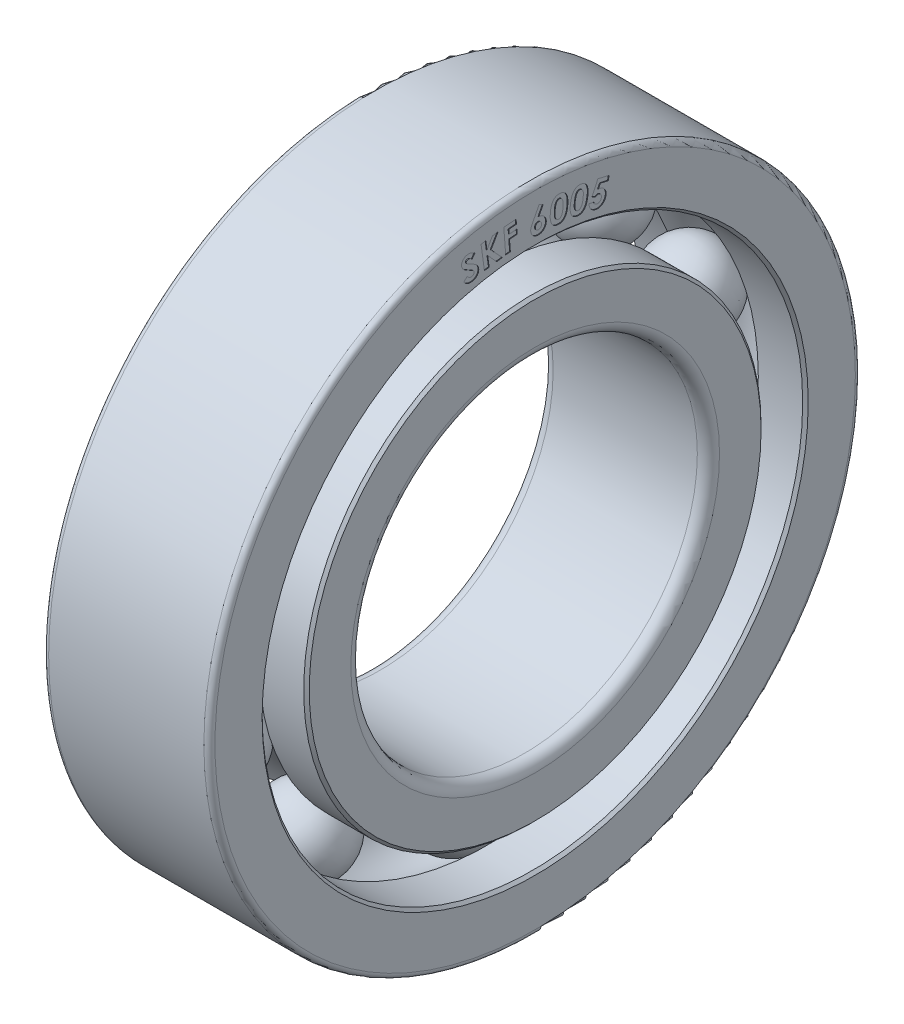
from build123d import *

# Parameters (mm, degrees)
CIRPATTERN1_COUNT = 10
WRAP1_START       = -0.05
WRAP1_DEPTH       = 0.05


# Read off the part's stored shape, not the designer's step: Wrap1
with BuildPart() as part:
    # Sketch1 → Revolve1 (revolve)
    with BuildSketch(Plane.XY, mode=Mode.PRIVATE) as revolve1_sk:
        with BuildLine():
            Line((-11.8, 19.5), (-8.598076211, 19.5))
            ThreePointArc((-8.598076211, 19.5), (-6, 21), (-3.401923789, 19.5))
            Line((-3.401923789, 19.5), (-0.2, 19.5))
            Line((-0.2, 19.5), (0, 19.7))
            Line((0, 19.7), (0, 23.1))
            ThreePointArc((0, 23.1), (-0.117157288, 23.382842712), (-0.4, 23.5))
            Line((-0.4, 23.5), (-11.6, 23.5))
            ThreePointArc((-11.6, 23.5), (-11.882842712, 23.382842712), (-12, 23.1))
            Line((-12, 23.1), (-12, 19.7))
            Line((-12, 19.7), (-11.8, 19.5))
        make_face()
        with BuildLine():
            Line((-0.8, 12.5), (-11.2, 12.5))
            ThreePointArc((-11.2, 12.5), (-11.765685425, 12.734314575), (-12, 13.3))
            Line((-12, 13.3), (-12, 16.3))
            Line((-12, 16.3), (-11.8, 16.5))
            Line((-11.8, 16.5), (-8.598076211, 16.5))
            ThreePointArc((-8.598076211, 16.5), (-6, 15), (-3.401923789, 16.5))
            Line((-3.401923789, 16.5), (-0.2, 16.5))
            Line((-0.2, 16.5), (0, 16.3))
            Line((0, 16.3), (0, 13.3))
            ThreePointArc((0, 13.3), (-0.234314575, 12.734314575), (-0.8, 12.5))
        make_face()
    revolve(revolve1_sk.sketch.rotate(Axis((0, 0, 0), (-1, 0, 0)), 90), axis=Axis((0, 0, 0), (-1, 0, 0)))

    # Wrap1 outline → Wrap1 (cut)
    # profile 1 of 7: a face of its own
    with BuildSketch(Plane(origin=(0, 0, 0), x_dir=(0, 0, -1), z_dir=(1, 0, 0)).offset(WRAP1_START)):
        with BuildLine():
            add(Edge.make_bspline(
                [(4.560573664, 20.891885224), (4.57091226, 20.892304512), (4.591237683, 20.893128822), (4.621190564, 20.891284417), (4.649839661, 20.888951427), (4.668172845, 20.885096082), (4.677040011, 20.883231378)],
                knots=[0, 0, 0, 0, 0.264824421, 0.520638247, 0.768148301, 1, 1, 1, 1], degree=3))
            Line((4.560573664, 20.891885224), (4.702640972, 21.192966955))
            Line((4.702640972, 21.192966955), (5.270549626, 21.066043878))
            Line((5.270549626, 21.066043878), (5.338698664, 21.371452531))
            Line((5.338698664, 21.371452531), (4.523434241, 21.553543878))
            Line((4.523434241, 21.553543878), (4.096871741, 20.634072724))
            Line((4.096871741, 20.634072724), (4.353241934, 20.513279455))
            add(Edge.make_bspline(
                [(4.587977511, 20.574938108), (4.578871157, 20.576603198), (4.560526351, 20.57995753), (4.53227479, 20.580928077), (4.503463339, 20.57834958), (4.474240737, 20.572080324), (4.4444849, 20.562508644), (4.414016832, 20.549976309), (4.383434084, 20.533181189), (4.363487798, 20.520033212), (4.353241934, 20.513279455)],
                knots=[0, 0, 0, 0, 0.111054174, 0.22371933, 0.338191352, 0.457650474, 0.581812816, 0.713158384, 0.852657264, 1, 1, 1, 1], degree=3))
            add(Edge.make_bspline(
                [(4.771511164, 20.244649647), (4.77347676, 20.254598544), (4.777316005, 20.274030943), (4.780229083, 20.303121047), (4.780437045, 20.331202417), (4.779067246, 20.35858187), (4.773587328, 20.384915787), (4.766618403, 20.410606569), (4.756683774, 20.435325144), (4.744523245, 20.459008517), (4.730261407, 20.481014762), (4.71454058, 20.501244341), (4.697374804, 20.519268728), (4.678397363, 20.534851009), (4.658047369, 20.548416448), (4.636044546, 20.559394985), (4.612700933, 20.568736148), (4.596329856, 20.572842892), (4.587977511, 20.574938108)],
                knots=[0, 0, 0, 0, 0.072112555, 0.14085178, 0.207545393, 0.271810935, 0.3353616, 0.398427314, 0.460980952, 0.524456807, 0.587539905, 0.647229237, 0.706488392, 0.764178689, 0.821564081, 0.880065939, 0.938810946, 1, 1, 1, 1], degree=3))
            add(Edge.make_bspline(
                [(4.444467895, 20.020731378), (4.453577211, 20.019007176), (4.471457835, 20.01562275), (4.498399716, 20.013376234), (4.524728181, 20.014204226), (4.550631263, 20.017325264), (4.575942553, 20.023655275), (4.60102305, 20.032252158), (4.625466521, 20.043903201), (4.649301573, 20.057934802), (4.671771641, 20.074351404), (4.692468056, 20.092798241), (4.710999265, 20.113267867), (4.72778586, 20.135522417), (4.741542039, 20.160283441), (4.754098962, 20.18639181), (4.764237762, 20.214671298), (4.769049275, 20.234502622), (4.771511164, 20.244649647)],
                knots=[0, 0, 0, 0, 0.062787982, 0.12324618, 0.182714598, 0.240994711, 0.299654761, 0.359145477, 0.420344987, 0.482772846, 0.546295829, 0.60858012, 0.670259929, 0.733127073, 0.796962466, 0.861802797, 0.929289116, 1, 1, 1, 1], degree=3))
            add(Edge.make_bspline(
                [(4.230285203, 20.242486185), (4.234317444, 20.227914289), (4.24212862, 20.199685909), (4.260462765, 20.160683118), (4.281730238, 20.125306039), (4.308154262, 20.094889185), (4.337646439, 20.068742814), (4.370572003, 20.047707379), (4.406201009, 20.031076605), (4.431600431, 20.024210021), (4.444467895, 20.020731378)],
                knots=[0, 0, 0, 0, 0.139108732, 0.269478593, 0.395828309, 0.518386693, 0.639271502, 0.757881256, 0.877341528, 1, 1, 1, 1], degree=3))
            Line((4.230285203, 20.242486185), (3.882689049, 20.320370801))
            add(Edge.make_bspline(
                [(4.368386164, 19.714962147), (4.350261461, 19.71932166), (4.314421102, 19.727942299), (4.263165616, 19.746350623), (4.214193044, 19.767084914), (4.168545015, 19.792180797), (4.125168953, 19.820215192), (4.085394743, 19.852576909), (4.047710356, 19.887611446), (4.013849502, 19.926492732), (3.982966322, 19.967942802), (3.956453429, 20.012026891), (3.933334002, 20.058039733), (3.915173553, 20.106486789), (3.90063424, 20.156869968), (3.890117143, 20.209432701), (3.884001112, 20.2642157), (3.883130304, 20.301485479), (3.882689049, 20.320370801)],
                knots=[0, 0, 0, 0, 0.066224855, 0.130955116, 0.193345704, 0.255103913, 0.315901223, 0.376694029, 0.437149529, 0.498609906, 0.559714257, 0.620683999, 0.681260181, 0.74252418, 0.804328196, 0.867512637, 0.932866075, 1, 1, 1, 1], degree=3))
            add(Edge.make_bspline(
                [(5.098554434, 20.185154455), (5.093439977, 20.164476887), (5.083363052, 20.123736235), (5.061296044, 20.065560964), (5.035182373, 20.010756391), (5.003475734, 19.960048581), (4.967277835, 19.912922145), (4.926263456, 19.869377761), (4.880307078, 19.82952644), (4.829675977, 19.794319476), (4.776494671, 19.763384419), (4.721433566, 19.738306524), (4.665207162, 19.719484253), (4.60795816, 19.706435148), (4.549495483, 19.699084472), (4.489925568, 19.698124028), (4.429157087, 19.703124833), (4.388880246, 19.71097019), (4.368386164, 19.714962147)],
                knots=[0, 0, 0, 0, 0.065986739, 0.130012529, 0.192511703, 0.253934026, 0.315051522, 0.376473845, 0.439082902, 0.503283044, 0.567391197, 0.629595286, 0.690518214, 0.750904285, 0.811360451, 0.872856205, 0.935305369, 1, 1, 1, 1], degree=3))
            add(Edge.make_bspline(
                [(4.677040011, 20.883231378), (4.696252679, 20.878413307), (4.733991574, 20.868949309), (4.788033274, 20.848966561), (4.838317743, 20.824311416), (4.885227449, 20.795552568), (4.927900149, 20.761506639), (4.9675874, 20.723731566), (5.002831299, 20.68064031), (5.034927209, 20.634155641), (5.062026299, 20.584284392), (5.084383845, 20.532488251), (5.10057692, 20.478738966), (5.111410735, 20.423299894), (5.116918004, 20.366047392), (5.116269103, 20.307021318), (5.110696167, 20.246292938), (5.102648617, 20.205770303), (5.098554434, 20.185154455)],
                knots=[0, 0, 0, 0, 0.065043487, 0.127763062, 0.188869411, 0.248811184, 0.308141075, 0.367906987, 0.428478918, 0.490692979, 0.553251983, 0.614644755, 0.675730685, 0.737299736, 0.799973298, 0.864341992, 0.930984128, 1, 1, 1, 1], degree=3))
        make_face()
    # profile 2 of 7: a face of its own
    with BuildSketch(Plane(origin=(0, 0, 0), x_dir=(0, 0, -1), z_dir=(1, 0, 0)).offset(WRAP1_START)):
        with BuildLine():
            add(Edge.make_bspline(
                [(3.793354577, 20.820619921), (3.789381765, 20.791976698), (3.781664409, 20.736336027), (3.766556806, 20.655857606), (3.750590292, 20.580495884), (3.732679836, 20.510279927), (3.712447493, 20.445500596), (3.690904415, 20.385724259), (3.667658112, 20.331176893), (3.642155704, 20.281836452), (3.615380218, 20.236822277), (3.587120888, 20.195662216), (3.558017807, 20.157737957), (3.527724883, 20.12320261), (3.495797672, 20.092589102), (3.463049425, 20.064860531), (3.428580284, 20.041161501), (3.393203123, 20.020277849), (3.355988569, 20.003364377), (3.317345579, 19.989207567), (3.276835436, 19.97823136), (3.234388147, 19.971440002), (3.190480632, 19.966382865), (3.144653535, 19.965580178), (3.097204384, 19.967697495), (3.06509272, 19.971387635), (3.048763231, 19.973264152)],
                knots=[0, 0, 0, 0, 0.067702401, 0.131514772, 0.191683064, 0.248066057, 0.301119717, 0.350531739, 0.396798805, 0.439846697, 0.480486813, 0.519361801, 0.556683775, 0.59237304, 0.626806247, 0.660174034, 0.692729609, 0.724636415, 0.756243924, 0.788295624, 0.820927748, 0.854333493, 0.888863177, 0.92433428, 0.961522312, 1, 1, 1, 1], degree=3))
            add(Edge.make_bspline(
                [(3.2914315, 21.837446845), (3.307343922, 21.835049605), (3.338541977, 21.830349553), (3.383869885, 21.819188442), (3.427307302, 21.805966809), (3.468757722, 21.789893129), (3.507867913, 21.77047046), (3.545197976, 21.748991716), (3.580149849, 21.724307654), (3.613210007, 21.697226681), (3.643890162, 21.667120361), (3.672522662, 21.634418901), (3.698118247, 21.598335574), (3.721551191, 21.559628312), (3.743098064, 21.518128678), (3.761090678, 21.4732559), (3.777536609, 21.425926087), (3.791187202, 21.375440284), (3.802582649, 21.321328753), (3.8103566, 21.262871521), (3.814681402, 21.20001536), (3.817194957, 21.132769642), (3.815195606, 21.061081064), (3.811438087, 20.984821577), (3.804187199, 20.9041125), (3.79703187, 20.848962706), (3.793354577, 20.820619921)],
                knots=[0, 0, 0, 0, 0.037496831, 0.073516668, 0.108702927, 0.143305305, 0.177014649, 0.210415134, 0.243608117, 0.276650559, 0.3099392, 0.343705559, 0.377841921, 0.412922031, 0.449138596, 0.486707595, 0.525519346, 0.565896619, 0.608540729, 0.654350091, 0.703241101, 0.755385757, 0.811157191, 0.870360072, 0.933374973, 1, 1, 1, 1], degree=3))
            add(Edge.make_bspline(
                [(2.792032462, 21.659682421), (2.808826941, 21.676935207), (2.841770054, 21.71077731), (2.897016125, 21.753415516), (2.955219544, 21.788131978), (3.016512523, 21.81469159), (3.081057876, 21.83282485), (3.148629858, 21.842760917), (3.219357937, 21.845255997), (3.267063335, 21.840087129), (3.2914315, 21.837446845)],
                knots=[0, 0, 0, 0, 0.130496671, 0.255974998, 0.37731346, 0.497357162, 0.617292779, 0.739947003, 0.867163576, 1, 1, 1, 1], degree=3))
            add(Edge.make_bspline(
                [(2.545758424, 20.972062229), (2.551568028, 21.011296669), (2.562781519, 21.087025584), (2.584192851, 21.195803546), (2.609864303, 21.295399255), (2.638302736, 21.386316546), (2.67102736, 21.46793438), (2.707186251, 21.540584312), (2.746291412, 21.604866266), (2.777162496, 21.641862228), (2.792032462, 21.659682421)],
                knots=[0, 0, 0, 0, 0.160725242, 0.310226129, 0.449042117, 0.577363454, 0.696036472, 0.804954813, 0.906050749, 1, 1, 1, 1], degree=3))
            add(Edge.make_bspline(
                [(3.048763231, 19.973264152), (3.032494969, 19.97567632), (3.000474441, 19.980424146), (2.954015439, 19.991394571), (2.909818323, 20.004759162), (2.8678648, 20.020467368), (2.828500142, 20.039312958), (2.7915195, 20.060701867), (2.756847291, 20.084478036), (2.724485416, 20.110863329), (2.694830105, 20.140445364), (2.667086512, 20.172393654), (2.641645143, 20.207189886), (2.619038466, 20.245047926), (2.598040873, 20.285263641), (2.579675372, 20.328484861), (2.563506797, 20.374386762), (2.549219717, 20.423284336), (2.538053288, 20.476070938), (2.529944584, 20.533168705), (2.524357972, 20.594907393), (2.523124502, 20.661358647), (2.523462856, 20.732460276), (2.528253412, 20.808209803), (2.535331853, 20.888664695), (2.542214503, 20.943715972), (2.545758424, 20.972062229)],
                knots=[0, 0, 0, 0, 0.038772736, 0.07631568, 0.112453997, 0.147622079, 0.181855821, 0.215257946, 0.248281444, 0.280910845, 0.313583312, 0.346943312, 0.380622141, 0.415089802, 0.450842511, 0.487542343, 0.525735655, 0.565568444, 0.607599884, 0.652859579, 0.701518419, 0.753695438, 0.809541141, 0.869166135, 0.9326328, 1, 1, 1, 1], degree=3))
        make_face()
        with BuildLine():
            add(Edge.make_bspline(
                [(2.882176693, 20.919417998), (2.878712217, 20.892398827), (2.872072473, 20.840615994), (2.865990061, 20.765657872), (2.86297755, 20.696975499), (2.86306172, 20.63425606), (2.866895446, 20.577746201), (2.874022205, 20.527224898), (2.884008627, 20.482710311), (2.898256102, 20.444161035), (2.915638245, 20.411036186), (2.934257522, 20.381680066), (2.95485163, 20.355896395), (2.978217946, 20.334653892), (3.00313341, 20.316670808), (3.030291501, 20.302905898), (3.059335122, 20.292456015), (3.079816376, 20.289055541), (3.090229577, 20.287326652)],
                knots=[0, 0, 0, 0, 0.110494452, 0.21176504, 0.304976072, 0.389330268, 0.466069304, 0.534542058, 0.596159802, 0.650774051, 0.700713193, 0.747645948, 0.791661433, 0.834104032, 0.875367953, 0.915928741, 0.957255989, 1, 1, 1, 1], degree=3))
            add(Edge.make_bspline(
                [(3.256455539, 21.515812229), (3.242516413, 21.517046427), (3.214913105, 21.51949048), (3.173666383, 21.514130872), (3.133965346, 21.501527072), (3.102547283, 21.485388105), (3.078374099, 21.468629833), (3.060850502, 21.453028778), (3.043794358, 21.435048318), (3.028060902, 21.414015791), (3.012047246, 21.391221254), (2.997278718, 21.36531301), (2.983397743, 21.336757684), (2.969488627, 21.305610157), (2.956463005, 21.27106951), (2.944309732, 21.232615711), (2.932453955, 21.190299892), (2.921358889, 21.143833449), (2.910489012, 21.093490233), (2.900596087, 21.038968134), (2.890700535, 20.980588831), (2.88507638, 20.940227426), (2.882176693, 20.919417998)],
                knots=[0, 0, 0, 0, 0.053456951, 0.105859485, 0.15796816, 0.212307328, 0.240395868, 0.270398578, 0.301979904, 0.335118981, 0.370862449, 0.408594922, 0.449141373, 0.492411897, 0.539166773, 0.590398232, 0.646787929, 0.70739917, 0.773292727, 0.843970679, 0.919554814, 1, 1, 1, 1], degree=3))
            add(Edge.make_bspline(
                [(3.456575731, 20.862446845), (3.460119038, 20.89043125), (3.466936256, 20.944272419), (3.473892217, 21.021955238), (3.477228632, 21.093300684), (3.477342877, 21.158155521), (3.474466594, 21.216732394), (3.467574288, 21.268906419), (3.458062005, 21.314883241), (3.443971172, 21.354480295), (3.42760025, 21.388835813), (3.4091712, 21.41889462), (3.388964976, 21.445246516), (3.366473641, 21.467403975), (3.341959223, 21.485707759), (3.315519493, 21.500369857), (3.286721846, 21.510584658), (3.266618928, 21.514056817), (3.256455539, 21.515812229)],
                knots=[0, 0, 0, 0, 0.111913898, 0.215319034, 0.309363583, 0.395203079, 0.472577755, 0.541844536, 0.603863567, 0.658462339, 0.708161557, 0.754618193, 0.798116897, 0.839595023, 0.879462814, 0.919159105, 0.959129443, 1, 1, 1, 1], degree=3))
            add(Edge.make_bspline(
                [(3.301888231, 20.382158383), (3.310822902, 20.394356767), (3.329590974, 20.419980558), (3.353319227, 20.464164176), (3.375829473, 20.514458225), (3.395597804, 20.571544174), (3.414046097, 20.63495365), (3.430501447, 20.704878761), (3.444838108, 20.781431218), (3.452566059, 20.834771212), (3.456575731, 20.862446845)],
                knots=[0, 0, 0, 0, 0.088884478, 0.186709757, 0.294358697, 0.412921039, 0.541844703, 0.682862232, 0.835452017, 1, 1, 1, 1], degree=3))
            add(Edge.make_bspline(
                [(3.090229577, 20.287326652), (3.100314732, 20.286324169), (3.120118606, 20.284355626), (3.149528436, 20.286253015), (3.17777899, 20.292145852), (3.205107377, 20.301843869), (3.23106356, 20.316258889), (3.256306484, 20.334039495), (3.280165748, 20.356237458), (3.294498084, 20.373339895), (3.301888231, 20.382158383)],
                knots=[0, 0, 0, 0, 0.124617305, 0.244706755, 0.361082867, 0.479038204, 0.600207723, 0.725438522, 0.858428536, 1, 1, 1, 1], degree=3))
        make_face(mode=Mode.SUBTRACT)
    # profile 3 of 7: a face of its own
    with BuildSketch(Plane(origin=(0, 0, 0), x_dir=(0, 0, -1), z_dir=(1, 0, 0)).offset(WRAP1_START)):
        with BuildLine():
            add(Edge.make_bspline(
                [(2.35098723, 21.024524151), (2.348669505, 20.995657324), (2.3441621, 20.939518469), (2.334179993, 20.85803179), (2.323097733, 20.78154415), (2.308732855, 20.710307328), (2.293206437, 20.644024799), (2.275244233, 20.582953666), (2.25501286, 20.52707508), (2.232655974, 20.476027307), (2.208224469, 20.429442102), (2.183064901, 20.386123257), (2.156022964, 20.346609369), (2.127690081, 20.310168666), (2.098071328, 20.276979916), (2.066398349, 20.247777369), (2.033827123, 20.221453293), (1.999573574, 20.198704856), (1.963410633, 20.179414819), (1.925490632, 20.163258228), (1.885646848, 20.149749787), (1.843755553, 20.139733748), (1.799966542, 20.132975775), (1.75431659, 20.129079462), (1.706608578, 20.127817536), (1.674178659, 20.129694368), (1.657597807, 20.130653959)],
                knots=[0, 0, 0, 0, 0.067606406, 0.131477778, 0.191643372, 0.24799864, 0.301088721, 0.350545761, 0.396529971, 0.439753828, 0.480545373, 0.519288373, 0.556648946, 0.592238081, 0.627009069, 0.660366415, 0.692709753, 0.724698103, 0.756210247, 0.788267452, 0.820835227, 0.854322162, 0.888693385, 0.924186138, 0.961237695, 1, 1, 1, 1], degree=3))
            add(Edge.make_bspline(
                [(1.785963192, 22.011783767), (1.801976137, 22.010321968), (1.83354009, 22.00744054), (1.879791144, 21.999363823), (1.924165323, 21.988663476), (1.966585322, 21.974882637), (2.007088948, 21.958260027), (2.045742217, 21.93884886), (2.082326136, 21.91629871), (2.117033861, 21.891102557), (2.149659074, 21.862699511), (2.180351047, 21.8315897), (2.208049921, 21.796801573), (2.234343477, 21.759770193), (2.257451985, 21.719026194), (2.279417747, 21.67597116), (2.297879611, 21.629299245), (2.315062764, 21.579859841), (2.329624542, 21.526301532), (2.340971752, 21.468323664), (2.3494197, 21.405700289), (2.355777284, 21.338467204), (2.358092176, 21.266492319), (2.359190321, 21.189893251), (2.356357472, 21.108719461), (2.352811235, 21.053121126), (2.35098723, 21.024524151)],
                knots=[0, 0, 0, 0, 0.03735145, 0.073625396, 0.108985718, 0.143343531, 0.177160134, 0.210634766, 0.243734452, 0.276917694, 0.310180767, 0.344151569, 0.378305578, 0.413404624, 0.449571965, 0.487043307, 0.525630502, 0.566082972, 0.608632153, 0.654478221, 0.703258975, 0.755424354, 0.811328002, 0.870541154, 0.933412911, 1, 1, 1, 1], degree=3))
            add(Edge.make_bspline(
                [(1.297020884, 21.803009728), (1.312842002, 21.821303841), (1.34377136, 21.857067758), (1.396284876, 21.903341602), (1.452605754, 21.941413082), (1.51230321, 21.972092391), (1.575849849, 21.99407162), (1.642739762, 22.008715426), (1.713401364, 22.014773318), (1.761443457, 22.012793981), (1.785963192, 22.011783767)],
                knots=[0, 0, 0, 0, 0.130738837, 0.255586769, 0.377322549, 0.497715476, 0.61760867, 0.740047481, 0.867325375, 1, 1, 1, 1], degree=3))
            add(Edge.make_bspline(
                [(1.092573769, 21.099524151), (1.095950868, 21.139223463), (1.102464869, 21.215798467), (1.117514973, 21.325949442), (1.136891081, 21.427188994), (1.160187916, 21.519711761), (1.187216053, 21.603697152), (1.219044939, 21.678738902), (1.254512408, 21.745439471), (1.283219419, 21.784318069), (1.297020884, 21.803009728)],
                knots=[0, 0, 0, 0, 0.160953581, 0.310459312, 0.448932877, 0.5771911, 0.695741221, 0.804966732, 0.90623388, 1, 1, 1, 1], degree=3))
            add(Edge.make_bspline(
                [(1.657597807, 20.130653959), (1.641102566, 20.132103972), (1.608696484, 20.134952625), (1.561529026, 20.143104351), (1.516359604, 20.153367174), (1.473637826, 20.167133704), (1.433056801, 20.183442863), (1.394484735, 20.202076496), (1.358514696, 20.224281805), (1.324387714, 20.248819872), (1.292546855, 20.276229886), (1.263254926, 20.306877397), (1.235692472, 20.340195387), (1.210183848, 20.376445106), (1.187116772, 20.415784473), (1.165645425, 20.457690035), (1.146802933, 20.502745377), (1.129502547, 20.550761575), (1.115094956, 20.60282531), (1.103261055, 20.65941902), (1.094342387, 20.720957602), (1.088347688, 20.78727723), (1.085152088, 20.858503614), (1.085039019, 20.934512875), (1.087030436, 21.015455094), (1.090688211, 21.070928158), (1.092573769, 21.099524151)],
                knots=[0, 0, 0, 0, 0.038920831, 0.076462755, 0.112453508, 0.147758619, 0.181871669, 0.215240199, 0.248345578, 0.281134582, 0.313996585, 0.346976262, 0.380701939, 0.415594004, 0.451074018, 0.487855052, 0.526227144, 0.565827493, 0.607793741, 0.653134948, 0.701697404, 0.753921297, 0.809655867, 0.86928974, 0.932619734, 1, 1, 1, 1], degree=3))
        make_face()
        with BuildLine():
            add(Edge.make_bspline(
                [(1.432597807, 21.067432805), (1.430854921, 21.040278805), (1.427502451, 20.988047631), (1.42555982, 20.912749475), (1.426952183, 20.843686096), (1.431135829, 20.780975892), (1.438030549, 20.724531084), (1.448406516, 20.674593107), (1.461547789, 20.630895165), (1.477911667, 20.59319875), (1.496845913, 20.560835808), (1.517611998, 20.53274452), (1.539934713, 20.508359969), (1.564272466, 20.487941964), (1.590466647, 20.471500428), (1.618524581, 20.459173917), (1.648382142, 20.450631436), (1.669083309, 20.448382335), (1.679593, 20.447240498)],
                knots=[0, 0, 0, 0, 0.110065989, 0.211713775, 0.304600997, 0.389403173, 0.465873356, 0.534436415, 0.595492573, 0.650143537, 0.700261321, 0.746841528, 0.791225696, 0.833682502, 0.874964899, 0.915890712, 0.957298901, 1, 1, 1, 1], degree=3))
            add(Edge.make_bspline(
                [(1.770818961, 21.687264536), (1.75673516, 21.687629143), (1.728956661, 21.688348285), (1.687757467, 21.680957189), (1.648894787, 21.665732972), (1.618180845, 21.647851899), (1.595501267, 21.629249054), (1.578662791, 21.612884878), (1.56286775, 21.593761332), (1.548178504, 21.571808716), (1.533671278, 21.547777118), (1.520251978, 21.52090637), (1.508387066, 21.491273065), (1.496073809, 21.459388026), (1.48532021, 21.423925677), (1.475400406, 21.384789665), (1.465862362, 21.341664811), (1.457858178, 21.294568193), (1.450194017, 21.24348627), (1.443480598, 21.188407352), (1.43721284, 21.129283502), (1.434167993, 21.088476443), (1.432597807, 21.067432805)],
                knots=[0, 0, 0, 0, 0.053667675, 0.10585263, 0.158411185, 0.212295993, 0.240663866, 0.270180285, 0.301776072, 0.335108668, 0.37090051, 0.408849287, 0.449566136, 0.492674861, 0.539246264, 0.590865748, 0.646736447, 0.707742787, 0.77313022, 0.843847516, 0.919474316, 1, 1, 1, 1], degree=3))
            add(Edge.make_bspline(
                [(2.010963192, 21.04579819), (2.012883488, 21.07403247), (2.016574325, 21.128299168), (2.018094766, 21.20648772), (2.017780996, 21.278064549), (2.013948765, 21.343086372), (2.006862766, 21.401503633), (1.996993327, 21.45327649), (1.984178898, 21.498389981), (1.968301133, 21.537247055), (1.94940535, 21.57027938), (1.929748239, 21.599655598), (1.907567815, 21.624480737), (1.88409676, 21.645930686), (1.858308715, 21.662577453), (1.830664346, 21.674941115), (1.801489274, 21.683931997), (1.78109676, 21.686147783), (1.770818961, 21.687264536)],
                knots=[0, 0, 0, 0, 0.112021211, 0.215306406, 0.309527997, 0.395339406, 0.473011103, 0.542348697, 0.603789507, 0.658401616, 0.708039979, 0.754235914, 0.798059935, 0.839512877, 0.879768689, 0.918952797, 0.959152323, 1, 1, 1, 1], degree=3))
            add(Edge.make_bspline(
                [(1.885843, 20.555774151), (1.894062463, 20.568470946), (1.911347167, 20.595171029), (1.932603623, 20.640699565), (1.951669959, 20.6924602), (1.968008375, 20.750769541), (1.982321282, 20.815425562), (1.994498056, 20.886413659), (2.004177921, 20.963911025), (2.008641059, 21.017773826), (2.010963192, 21.04579819)],
                knots=[0, 0, 0, 0, 0.088703123, 0.18653375, 0.294137609, 0.412280456, 0.541692921, 0.682745675, 0.834935232, 1, 1, 1, 1], degree=3))
            add(Edge.make_bspline(
                [(1.679593, 20.447240498), (1.689693261, 20.446844316), (1.709606308, 20.44606323), (1.73907667, 20.449678852), (1.767020736, 20.457827041), (1.793751512, 20.469481675), (1.819126607, 20.485120438), (1.8430472, 20.504838863), (1.865591547, 20.528528013), (1.878939793, 20.546486634), (1.885843, 20.555774151)],
                knots=[0, 0, 0, 0, 0.123742512, 0.243963027, 0.36192431, 0.479332474, 0.600344514, 0.725957866, 0.858275805, 1, 1, 1, 1], degree=3))
        make_face(mode=Mode.SUBTRACT)
    # profile 4 of 7: a face of its own
    with BuildSketch(Plane(origin=(0, 0, 0), x_dir=(0, 0, -1), z_dir=(1, 0, 0)).offset(WRAP1_START)):
        with BuildLine():
            add(Edge.make_bspline(
                [(0.26048734, 21.319505928), (0.279148331, 21.318802471), (0.315811119, 21.317420407), (0.369691262, 21.308867637), (0.421302877, 21.295430385), (0.47117434, 21.27769483), (0.518107084, 21.253396087), (0.563170838, 21.224742579), (0.606196975, 21.191208687), (0.646157032, 21.152590996), (0.683276399, 21.111041223), (0.71507626, 21.065850206), (0.742372068, 21.018519428), (0.764353325, 20.968555368), (0.781458801, 20.916269367), (0.793264875, 20.861538285), (0.80032073, 20.80431011), (0.800765626, 20.765319695), (0.800992148, 20.745467466)],
                knots=[0, 0, 0, 0, 0.063700778, 0.125151336, 0.185753709, 0.245588764, 0.30540553, 0.365728104, 0.427692868, 0.491244168, 0.555198125, 0.617582535, 0.679514692, 0.741418303, 0.803566165, 0.866980907, 0.932272443, 1, 1, 1, 1], degree=3))
            Line((0.26048734, 21.319505928), (0.579597917, 21.924914582))
            Line((0.579597917, 21.924914582), (0.291496955, 22.07275112))
            Line((0.291496955, 22.07275112), (-0.177974199, 21.176717466))
            add(Edge.make_bspline(
                [(-0.322204968, 20.753400158), (-0.321821263, 20.767235556), (-0.321048077, 20.795114663), (-0.315899369, 20.836846247), (-0.307325937, 20.87855879), (-0.298257127, 20.913854135), (-0.287990629, 20.943403622), (-0.27883858, 20.968721734), (-0.266591891, 20.996381204), (-0.252924754, 21.027042358), (-0.237511721, 21.060742703), (-0.219358919, 21.09687019), (-0.199551611, 21.136008929), (-0.185351732, 21.162798809), (-0.177974199, 21.176717466)],
                knots=[0, 0, 0, 0, 0.091812954, 0.185008287, 0.278551124, 0.374322003, 0.426534136, 0.486094508, 0.552913929, 0.627178303, 0.708902245, 0.798792991, 0.895463084, 1, 1, 1, 1], degree=3))
            add(Edge.make_bspline(
                [(0.236689263, 20.192703043), (0.216944719, 20.193382893), (0.177988699, 20.194724237), (0.121000649, 20.203640358), (0.06652456, 20.217316329), (0.014611883, 20.236112484), (-0.034688836, 20.26029154), (-0.08104352, 20.290347525), (-0.125306914, 20.324888066), (-0.165891837, 20.36477617), (-0.202640499, 20.40780251), (-0.235567684, 20.452423074), (-0.262369292, 20.49925565), (-0.285272004, 20.546993766), (-0.302077425, 20.596574961), (-0.313966836, 20.647537968), (-0.321615812, 20.699920602), (-0.322007385, 20.735464923), (-0.322204968, 20.753400158)],
                knots=[0, 0, 0, 0, 0.067328577, 0.1328394, 0.196270313, 0.258644694, 0.320792365, 0.383106101, 0.446743311, 0.511967507, 0.576793738, 0.639601694, 0.700769614, 0.760550994, 0.8199234, 0.878885421, 0.938887048, 1, 1, 1, 1], degree=3))
            add(Edge.make_bspline(
                [(0.800992148, 20.745467466), (0.800294066, 20.726324268), (0.798922119, 20.688701913), (0.790287187, 20.633419337), (0.777211906, 20.580429324), (0.758437379, 20.529788933), (0.73517652, 20.481228539), (0.705884618, 20.435405828), (0.672255847, 20.391357437), (0.633636036, 20.350503118), (0.591610127, 20.313155752), (0.547312571, 20.280066775), (0.500450877, 20.252533091), (0.451618793, 20.230162432), (0.40083997, 20.212528888), (0.347805754, 20.200966042), (0.292927643, 20.193267006), (0.25558655, 20.192892546), (0.236689263, 20.192703043)],
                knots=[0, 0, 0, 0, 0.065323678, 0.128381405, 0.190559154, 0.251291348, 0.312381252, 0.373948514, 0.436546971, 0.501258641, 0.565469168, 0.628228685, 0.689642719, 0.750578196, 0.811285451, 0.872683046, 0.935568438, 1, 1, 1, 1], degree=3))
        make_face()
        with BuildLine():
            add(Edge.make_bspline(
                [(0.011328686, 20.758808812), (0.011864338, 20.742139512), (0.012908969, 20.709630922), (0.025668672, 20.663052569), (0.046652409, 20.620500267), (0.07576957, 20.583202546), (0.110155192, 20.552033988), (0.148547109, 20.528939375), (0.190153651, 20.51456236), (0.219150494, 20.512496877), (0.233804648, 20.511453043)],
                knots=[0, 0, 0, 0, 0.135224471, 0.263715746, 0.389156449, 0.518761666, 0.646106758, 0.764439774, 0.880954771, 1, 1, 1, 1], degree=3))
            add(Edge.make_bspline(
                [(0.237770994, 20.997150158), (0.222403076, 20.996659258), (0.192418538, 20.995701457), (0.149614304, 20.982210332), (0.110364771, 20.960990604), (0.076294968, 20.930947435), (0.047544297, 20.894986653), (0.026696522, 20.8535067), (0.014217787, 20.807470751), (0.012310929, 20.775353008), (0.011328686, 20.758808812)],
                knots=[0, 0, 0, 0, 0.125207775, 0.244294468, 0.363052186, 0.48778071, 0.613034767, 0.737425939, 0.864745266, 1, 1, 1, 1], degree=3))
            add(Edge.make_bspline(
                [(0.467458494, 20.754121312), (0.466904018, 20.770783515), (0.46583145, 20.803014559), (0.45351913, 20.849340602), (0.432559427, 20.891005141), (0.404098897, 20.927839747), (0.369217467, 20.958043959), (0.329413897, 20.980753199), (0.284918634, 20.994469896), (0.253731872, 20.99624281), (0.237770994, 20.997150158)],
                knots=[0, 0, 0, 0, 0.133600665, 0.258434547, 0.381504528, 0.506080469, 0.629980993, 0.749749056, 0.87192563, 1, 1, 1, 1], degree=3))
            add(Edge.make_bspline(
                [(0.233804648, 20.511453043), (0.249162049, 20.512123104), (0.279347466, 20.513440128), (0.322854103, 20.526704266), (0.362911982, 20.548452512), (0.398674321, 20.578431066), (0.429097881, 20.614813898), (0.450887953, 20.657212349), (0.464928927, 20.704089444), (0.466596394, 20.737069996), (0.467458494, 20.754121312)],
                knots=[0, 0, 0, 0, 0.122550959, 0.240877457, 0.360032907, 0.484970173, 0.612001885, 0.736702204, 0.863872077, 1, 1, 1, 1], degree=3))
        make_face(mode=Mode.SUBTRACT)
    # profile 5 of 7: a face of its own
    with BuildSketch(Plane(origin=(0, 0, 0), x_dir=(0, 0, -1), z_dir=(1, 0, 0)).offset(WRAP1_START)):
        with BuildLine():
            add(Edge.make_bspline(
                [(-4.549525872, 21.074978271), (-4.563291617, 21.086853935), (-4.589714342, 21.109648734), (-4.630579318, 21.139023615), (-4.670426408, 21.162596854), (-4.708965014, 21.181181918), (-4.746835021, 21.192910523), (-4.783298656, 21.200392424), (-4.81897884, 21.201242098), (-4.841871012, 21.197333565), (-4.853131641, 21.195410963)],
                knots=[0, 0, 0, 0, 0.160874974, 0.30879222, 0.444726653, 0.570380105, 0.686462828, 0.79475666, 0.899041069, 1, 1, 1, 1], degree=3))
            Line((-4.549525872, 21.074978271), (-4.353732603, 21.347213848))
            add(Edge.make_bspline(
                [(-4.920198949, 21.513439809), (-4.898516895, 21.51760211), (-4.855423726, 21.5258747), (-4.78958503, 21.528387202), (-4.72374801, 21.523374114), (-4.668963839, 21.512327909), (-4.624426371, 21.49967944), (-4.58967806, 21.486289226), (-4.553386404, 21.470572667), (-4.51587012, 21.451722667), (-4.477219423, 21.429920169), (-4.437087422, 21.405387562), (-4.395698634, 21.377562789), (-4.367975861, 21.357514269), (-4.353732603, 21.347213848)],
                knots=[0, 0, 0, 0, 0.108240894, 0.215129209, 0.322232224, 0.431686642, 0.488819109, 0.549307292, 0.61430283, 0.682901581, 0.755275432, 0.832073209, 0.913723475, 1, 1, 1, 1], degree=3))
            add(Edge.make_bspline(
                [(-5.298444141, 20.965002309), (-5.301409884, 20.979978876), (-5.307234122, 21.009390427), (-5.310360594, 21.053903672), (-5.308995723, 21.097782542), (-5.302741199, 21.141013918), (-5.292351625, 21.183788233), (-5.276518961, 21.225536653), (-5.256764912, 21.267048735), (-5.231705588, 21.306899609), (-5.203865139, 21.345416988), (-5.171676667, 21.379950746), (-5.137409514, 21.411738064), (-5.099807345, 21.439554122), (-5.059022258, 21.463339132), (-5.015565124, 21.484068507), (-4.969056255, 21.501042918), (-4.936626445, 21.50927155), (-4.920198949, 21.513439809)],
                knots=[0, 0, 0, 0, 0.06171903, 0.121206179, 0.180077983, 0.239014018, 0.297630211, 0.35778933, 0.41933955, 0.483308703, 0.547985532, 0.611313816, 0.673955056, 0.736880657, 0.800096823, 0.864698657, 0.93146237, 1, 1, 1, 1], degree=3))
            add(Edge.make_bspline(
                [(-4.71034318, 20.457670578), (-4.737342493, 20.471104226), (-4.789232488, 20.496922363), (-4.862693145, 20.536439489), (-4.929367255, 20.573439134), (-4.989175081, 20.608200102), (-5.041389855, 20.641870378), (-5.087036577, 20.673114986), (-5.125808212, 20.702436385), (-5.167028442, 20.738911576), (-5.209376736, 20.784654064), (-5.249595945, 20.84238904), (-5.280960401, 20.902021607), (-5.292664394, 20.944182248), (-5.298444141, 20.965002309)],
                knots=[0, 0, 0, 0, 0.112739444, 0.216674004, 0.311821862, 0.397829583, 0.475237131, 0.544042193, 0.604619308, 0.656826457, 0.749686643, 0.836823269, 0.91941893, 1, 1, 1, 1], degree=3))
            add(Edge.make_bspline(
                [(-4.40565568, 20.212117694), (-4.40858542, 20.221853485), (-4.414542125, 20.241648149), (-4.429735245, 20.269823445), (-4.450809107, 20.296249369), (-4.472507111, 20.317269783), (-4.493714036, 20.33417238), (-4.513743549, 20.348116991), (-4.537157438, 20.363750078), (-4.564579284, 20.380150158), (-4.595760285, 20.397860225), (-4.630598815, 20.416896059), (-4.669192684, 20.437079467), (-4.696258524, 20.450622821), (-4.71034318, 20.457670578)],
                knots=[0, 0, 0, 0, 0.075532108, 0.153570737, 0.236424134, 0.326256682, 0.37780942, 0.438125348, 0.507844917, 0.587316312, 0.675861274, 0.774743301, 0.882779803, 1, 1, 1, 1], degree=3))
            add(Edge.make_bspline(
                [(-4.56971818, 20.001540771), (-4.556100675, 20.005303858), (-4.529767847, 20.012580724), (-4.493591839, 20.030612999), (-4.46259726, 20.054320958), (-4.437079641, 20.082797381), (-4.417661055, 20.114073041), (-4.405424451, 20.146630947), (-4.400329215, 20.179814375), (-4.403875286, 20.201320171), (-4.40565568, 20.212117694)],
                knots=[0, 0, 0, 0, 0.143333888, 0.27717168, 0.407879156, 0.537624185, 0.663741956, 0.779689106, 0.889387398, 1, 1, 1, 1], degree=3))
            add(Edge.make_bspline(
                [(-4.910463372, 20.167045578), (-4.896096078, 20.151126426), (-4.868544568, 20.120598986), (-4.824257801, 20.081394318), (-4.781210897, 20.048769904), (-4.738081589, 20.024085647), (-4.695355956, 20.006946498), (-4.652988478, 19.9966795), (-4.610706559, 19.994647354), (-4.583375983, 19.999243804), (-4.56971818, 20.001540771)],
                knots=[0, 0, 0, 0, 0.161605386, 0.309903346, 0.445331319, 0.568333789, 0.683469254, 0.791430087, 0.895772167, 1, 1, 1, 1], degree=3))
            Line((-4.910463372, 20.167045578), (-5.150247026, 19.935915771))
            add(Edge.make_bspline(
                [(-4.505174911, 19.685675386), (-4.52052178, 19.682456766), (-4.550697904, 19.676128082), (-4.596019484, 19.670430315), (-4.640477975, 19.667800497), (-4.684092958, 19.668624628), (-4.726892329, 19.672110954), (-4.768738393, 19.678962262), (-4.809728106, 19.689122214), (-4.84985148, 19.702554328), (-4.889539132, 19.719144423), (-4.928296929, 19.739877064), (-4.966794033, 19.763755661), (-5.004531539, 19.79136573), (-5.042331019, 19.821910736), (-5.078824305, 19.856851438), (-5.115528745, 19.894547048), (-5.138518346, 19.92194041), (-5.150247026, 19.935915771)],
                knots=[0, 0, 0, 0, 0.064031689, 0.125903737, 0.186390848, 0.245806416, 0.303948624, 0.361660135, 0.418817643, 0.476263312, 0.534349524, 0.594306273, 0.655612767, 0.719251735, 0.785197343, 0.8539683, 0.925498534, 1, 1, 1, 1], degree=3))
            add(Edge.make_bspline(
                [(-4.083660487, 20.300098463), (-4.080041448, 20.282488099), (-4.072947599, 20.247969199), (-4.068841534, 20.196086444), (-4.069453022, 20.145614162), (-4.075138494, 20.096251502), (-4.086442255, 20.048165674), (-4.102757009, 20.001394821), (-4.124224977, 19.955923066), (-4.150862645, 19.912313064), (-4.18157921, 19.870962608), (-4.216653062, 19.833182852), (-4.255048189, 19.798777591), (-4.297900958, 19.768794574), (-4.344058357, 19.741871019), (-4.394476541, 19.719398019), (-4.448329097, 19.700041849), (-4.485971115, 19.690528701), (-4.505174911, 19.685675386)],
                knots=[0, 0, 0, 0, 0.064477381, 0.126385137, 0.186356649, 0.245432372, 0.304347207, 0.363287309, 0.42291804, 0.484474571, 0.546424399, 0.607483078, 0.669211702, 0.731096907, 0.794880698, 0.860717692, 0.928942464, 1, 1, 1, 1], degree=3))
            add(Edge.make_bspline(
                [(-4.358059526, 20.655627309), (-4.338469108, 20.642738331), (-4.300944205, 20.618049852), (-4.250725764, 20.577251229), (-4.207294896, 20.536711157), (-4.171285917, 20.494586703), (-4.141571388, 20.450467797), (-4.116822496, 20.403657253), (-4.097223016, 20.35327254), (-4.088225455, 20.317996154), (-4.083660487, 20.300098463)],
                knots=[0, 0, 0, 0, 0.152098916, 0.291341257, 0.419347906, 0.537205561, 0.650138427, 0.763887286, 0.880206765, 1, 1, 1, 1], degree=3))
            add(Edge.make_bspline(
                [(-4.633179718, 20.803463848), (-4.6154073, 20.794178059), (-4.581578711, 20.776503192), (-4.533302627, 20.75188719), (-4.490689428, 20.729422633), (-4.453528887, 20.709629208), (-4.421931551, 20.692411713), (-4.395768313, 20.677803224), (-4.374894072, 20.666235264), (-4.363083375, 20.658792988), (-4.358059526, 20.655627309)],
                knots=[0, 0, 0, 0, 0.192569748, 0.366543424, 0.52040399, 0.655182204, 0.770886069, 0.865957706, 0.942983183, 1, 1, 1, 1], degree=3))
            add(Edge.make_bspline(
                [(-4.926689334, 20.971853271), (-4.921452825, 20.967813253), (-4.909271261, 20.958415057), (-4.887009206, 20.944396102), (-4.859329916, 20.926875545), (-4.825450671, 20.907401492), (-4.785968285, 20.884720908), (-4.740252877, 20.860122), (-4.688622344, 20.832727337), (-4.652294239, 20.813552792), (-4.633179718, 20.803463848)],
                knots=[0, 0, 0, 0, 0.058554951, 0.136214982, 0.232815618, 0.34876317, 0.482267778, 0.636143516, 0.808552018, 1, 1, 1, 1], degree=3))
            add(Edge.make_bspline(
                [(-4.975006641, 21.048295578), (-4.972950214, 21.041121475), (-4.968846211, 21.026804145), (-4.958488034, 21.006557917), (-4.944233373, 20.988075954), (-4.932624998, 20.977341881), (-4.926689334, 20.971853271)],
                knots=[0, 0, 0, 0, 0.242995251, 0.484944675, 0.736638812, 1, 1, 1, 1], degree=3))
            add(Edge.make_bspline(
                [(-4.853131641, 21.195410963), (-4.863449852, 21.192593664), (-4.883165654, 21.187210433), (-4.910373416, 21.17440594), (-4.933178568, 21.157253358), (-4.951903417, 21.137149096), (-4.965920418, 21.115371122), (-4.975096067, 21.093037897), (-4.978212988, 21.070272445), (-4.9760741, 21.055612129), (-4.975006641, 21.048295578)],
                knots=[0, 0, 0, 0, 0.15177997, 0.290017718, 0.424231584, 0.554722373, 0.678351824, 0.790284299, 0.895336795, 1, 1, 1, 1], degree=3))
        make_face()
    # profile 6 of 7: a face of its own
    with BuildSketch(Plane(origin=(0, 0, 0), x_dir=(0, 0, -1), z_dir=(1, 0, 0)).offset(WRAP1_START)):
        Polygon((-1.350349444, 21.657020572), (-1.375950405, 21.989472495), (-2.264051367, 21.921323457), (-2.126310982, 20.131059034), (-1.789532136, 20.157020572), (-1.851551367, 20.962549418), (-1.300229251, 21.004736918), (-1.325469636, 21.332140764), (-1.876791751, 21.289953264), (-1.901671559, 21.614833072), align=None)
    # profile 7 of 7: a face of its own
    with BuildSketch(Plane(origin=(0, 0, 0), x_dir=(0, 0, -1), z_dir=(1, 0, 0)).offset(WRAP1_START)):
        Polygon((-3.478729636, 21.116192627), (-3.562383482, 21.726288781), (-3.903849828, 21.679413781), (-3.660820982, 19.905735897), (-3.319354636, 19.952610897), (-3.427167136, 20.73975032), (-2.771998866, 20.027610897), (-2.371758482, 20.082418589), (-3.186301751, 20.971601281), (-2.675003674, 21.847803204), (-3.081373866, 21.791913781), align=None)
    extrude(amount=WRAP1_DEPTH, mode=Mode.SUBTRACT)


with BuildPart() as body_2:
    # Sketch3 → Revolve2 (revolve)
    with BuildSketch(Plane.XY):
        with BuildLine():
            Line((-6, 21), (-6, 15))
            ThreePointArc((-6, 15), (-3, 18), (-6, 21))
        make_face()
    revolve(axis=Axis((-6, 21, 0), (0, -1, 0)))


with BuildPart() as cirpattern1_1:
    # CirPattern1: pattern copy
    add(body_2.part.rotate(Axis((0, 0, 0), (1, 0, 0)), 1 * 360 / CIRPATTERN1_COUNT))


with BuildPart() as cirpattern1_2:
    # CirPattern1: pattern copy
    add(body_2.part.rotate(Axis((0, 0, 0), (1, 0, 0)), 2 * 360 / CIRPATTERN1_COUNT))


with BuildPart() as cirpattern1_3:
    # CirPattern1: pattern copy
    add(body_2.part.rotate(Axis((0, 0, 0), (1, 0, 0)), 3 * 360 / CIRPATTERN1_COUNT))


with BuildPart() as cirpattern1_4:
    # CirPattern1: pattern copy
    add(body_2.part.rotate(Axis((0, 0, 0), (1, 0, 0)), 4 * 360 / CIRPATTERN1_COUNT))


with BuildPart() as cirpattern1_5:
    # CirPattern1: pattern copy
    add(body_2.part.rotate(Axis((0, 0, 0), (1, 0, 0)), 5 * 360 / CIRPATTERN1_COUNT))


with BuildPart() as cirpattern1_6:
    # CirPattern1: pattern copy
    add(body_2.part.rotate(Axis((0, 0, 0), (1, 0, 0)), 6 * 360 / CIRPATTERN1_COUNT))


with BuildPart() as cirpattern1_7:
    # CirPattern1: pattern copy
    add(body_2.part.rotate(Axis((0, 0, 0), (1, 0, 0)), 7 * 360 / CIRPATTERN1_COUNT))


with BuildPart() as cirpattern1_8:
    # CirPattern1: pattern copy
    add(body_2.part.rotate(Axis((0, 0, 0), (1, 0, 0)), 8 * 360 / CIRPATTERN1_COUNT))


with BuildPart() as cirpattern1_9:
    # CirPattern1: pattern copy
    add(body_2.part.rotate(Axis((0, 0, 0), (1, 0, 0)), 9 * 360 / CIRPATTERN1_COUNT))


solid = Compound([part.part, body_2.part, cirpattern1_1.part, cirpattern1_2.part, cirpattern1_3.part, cirpattern1_4.part, cirpattern1_5.part, cirpattern1_6.part, cirpattern1_7.part, cirpattern1_8.part, cirpattern1_9.part])
